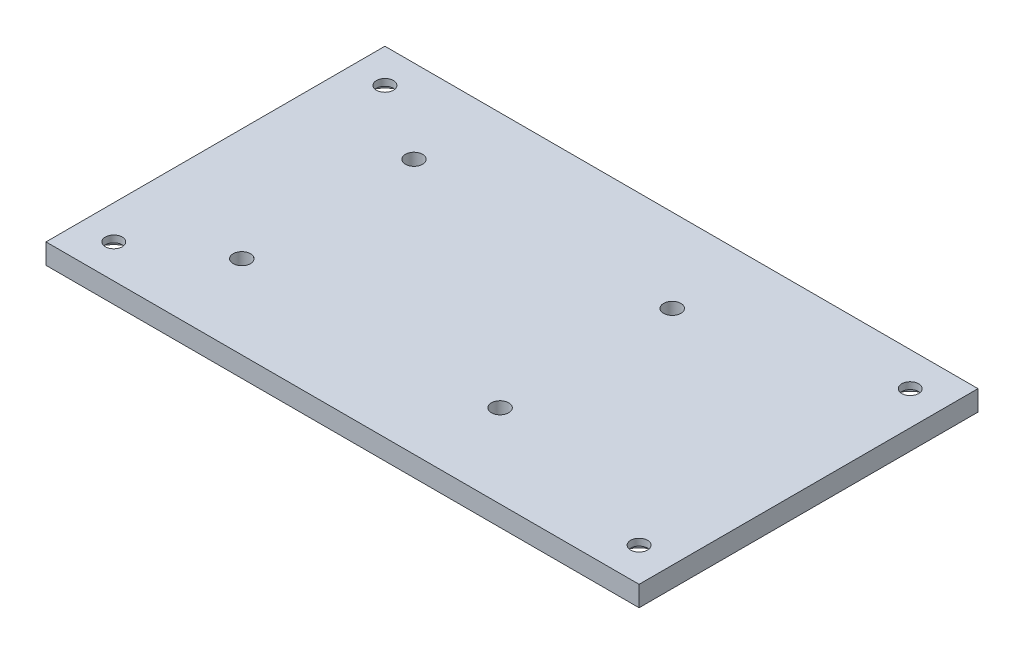
from build123d import *

# Parameters (mm, degrees)
SKETCH1_W           = 175
SKETCH1_H           = 100
SKETCH1_R           = 2.5
BOSS_EXTRUDE1_DEPTH = 6
SKETCH2_R           = 2.555
CUT_EXTRUDE1_DEPTH  = 101.956673875
SKETCH3_R           = 7.5
CUT_EXTRUDE2_DEPTH  = 4


with BuildPart() as part:
    # Sketch1 → Boss-Extrude1 (new body)
    with BuildSketch(Plane(origin=(0, 0, 0), x_dir=(1, 0, 0), z_dir=(0, 1, 0))):
        Rectangle(SKETCH1_W, SKETCH1_H)
        with Locations((-77.5, -40)):
            Circle(SKETCH1_R, mode=Mode.SUBTRACT)
        with Locations((-77.5, 40)):
            Circle(SKETCH1_R, mode=Mode.SUBTRACT)
        with Locations((77.5, 40)):
            Circle(SKETCH1_R, mode=Mode.SUBTRACT)
        with Locations((77.5, -40)):
            Circle(SKETCH1_R, mode=Mode.SUBTRACT)
    extrude(amount=BOSS_EXTRUDE1_DEPTH)

    # Sketch2 → Cut-Extrude1 (cut, through all)
    with BuildSketch(Plane(origin=(0, 6, 0), x_dir=(1, 0, 0), z_dir=(0, 1, 0))):
        with Locations((21.88, -25.4)):
            Circle(SKETCH2_R)
        with Locations((-54.32, -25.4)):
            Circle(SKETCH2_R)
        with Locations((21.88, 25.4)):
            Circle(SKETCH2_R)
        with Locations((-54.32, 25.4)):
            Circle(SKETCH2_R)
    extrude(amount=-CUT_EXTRUDE1_DEPTH, mode=Mode.SUBTRACT)

    # Sketch3 → Cut-Extrude2 (cut)
    with BuildSketch(Plane(origin=(0, 0, 0), x_dir=(1, 0, 0), z_dir=(0, 1, 0))):
        with Locations((-77.5, 40)):
            Circle(SKETCH3_R)
        with Locations((77.5, 40)):
            Circle(SKETCH3_R)
        with Locations((77.5, -40)):
            Circle(SKETCH3_R)
        with Locations((-77.5, -40)):
            Circle(SKETCH3_R)
    extrude(amount=CUT_EXTRUDE2_DEPTH, mode=Mode.SUBTRACT)


solid = part.part
